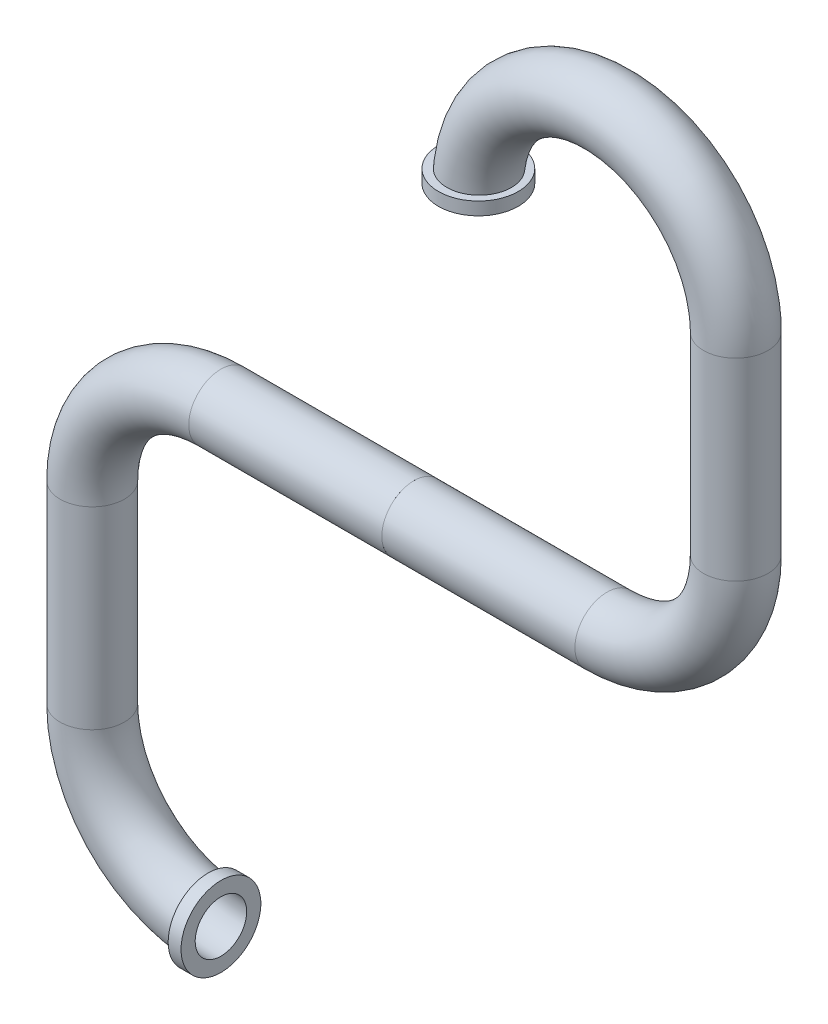
from build123d import *

# Parameters (mm, degrees)
SKETCH3_R             = 0.25
SKETCH3_R_2           = 0.2
SKETCH6_R             = 0.31
SKETCH6_R_2           = 0.21
SPLIT2_START          = -1
SPLIT2_OUTLINE_W      = 3
SPLIT2_OUTLINE_H      = 4
SPLIT2_DEPTH          = 1.31
SKETCH10_R            = 0.31
SKETCH10_R_2          = 0.21
BODY_MOVE_COPY2_ANGLE = 180


# Read off the part's stored shape, not the designer's step: Split1, Split2
with BuildPart() as part:
    # Sweep-Thin1: sweep along a path in Sketch1
    with BuildLine(Plane.XY) as sweep_thin1_path:
        Line((0.5, -2.5), (-1, -2.5))
        ThreePointArc((-1, -2.5), (-1.707106781, -2.207106781), (-2, -1.5))
        Line((-2, -1.5), (-2, 0))
        ThreePointArc((-2, 0), (-1, 1), (0, 0))
    # Sketch3 → Sweep-Thin1 (sweep)
    with BuildSketch(Plane(origin=(0, 0, 0), x_dir=(1, 0, 0), z_dir=(0, 1, 0))):
        Circle(SKETCH3_R)
        Circle(SKETCH3_R_2, mode=Mode.SUBTRACT)
    sweep(path=sweep_thin1_path.line)

    # Sweep-Thin2: sweep along a path in Sketch5
    with BuildLine(Plane.XY) as sweep_thin2_path:
        Line((0, 0), (0, 0.1))
    # Sketch6 → Sweep-Thin2 (sweep)
    with BuildSketch(Plane(origin=(0, 0, 0), x_dir=(1, 0, 0), z_dir=(0, 1, 0))):
        Circle(SKETCH6_R)
        Circle(SKETCH6_R_2, mode=Mode.SUBTRACT)
    sweep(path=sweep_thin2_path.line)

    # Mirror2: part across plane


with BuildPart() as part_1:
    add(part.part)
    add(part.part.mirror(Plane(origin=(0.5, -2.5, 0), x_dir=(0, 0, 1), z_dir=(1, 0, 0))))


with BuildPart() as body_2:
    # Split1: the piece on the far side of the plane
    add(part_1.part)
    split(bisect_by=Plane.YZ.offset(0.5), keep=Keep.BOTTOM)

    # Split2 outline → Split2 (cut)
    with BuildSketch(Plane.YZ.offset(SPLIT2_START)):
        with Locations((1.5, 0)):
            Rectangle(SPLIT2_OUTLINE_W, SPLIT2_OUTLINE_H)
    extrude(amount=SPLIT2_DEPTH, mode=Mode.SUBTRACT)

    # Sweep-Thin3: sweep along a path in Sketch11
    with BuildLine(Plane(origin=(0, 1, 0), x_dir=(1, 0, 0), z_dir=(0, 1, 0))) as sweep_thin3_path:
        Line((-1, 0), (-1.1, 0))
    # Sketch10 → Sweep-Thin3 (sweep)
    with BuildSketch(Plane(origin=(-1, 0, 0), x_dir=(0, 0, -1), z_dir=(1, 0, 0))):
        with Locations((0, 1)):
            Circle(SKETCH10_R)
        with Locations((0, 1)):
            Circle(SKETCH10_R_2, mode=Mode.SUBTRACT)
    sweep(path=sweep_thin3_path.line)


with BuildPart() as part_2:
    add(part_1.part)

    # Split1
    split(bisect_by=Plane.YZ.offset(0.5), keep=Keep.TOP)


with BuildPart() as body_2_1:
    # Body-Move/Copy2: moved
    add(body_2.part.rotate(Axis((0, -2.5, 0), (1, 0, 0)), BODY_MOVE_COPY2_ANGLE))


solid = Compound([part_2.part, body_2_1.part])
